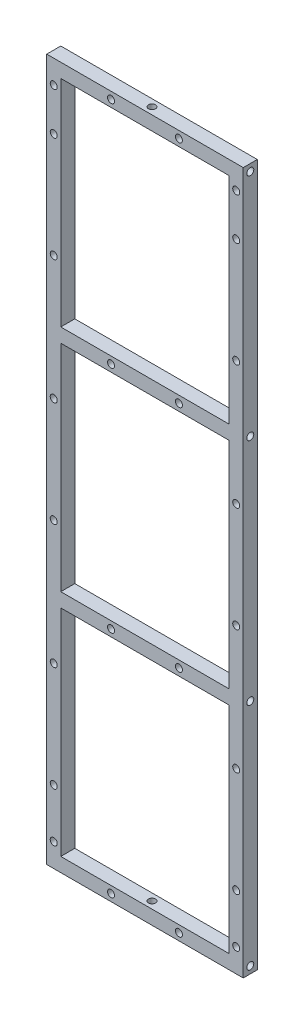
from build123d import *

# Parameters (mm, degrees)
SKETCH1_W            = 84
SKETCH1_H            = 300
SKETCH1_W_2          = 72
SKETCH1_H_2          = 92
BOSS_EXTRUDE1_DEPTH  = 6
SKETCH2_R            = 1.5
CUT_EXTRUDE1_DEPTH   = 10
SKETCH4_R            = 1.5
CUT_EXTRUDE3_DEPTH   = 10
SKETCH5_R            = 1.5
CUT_EXTRUDE4_DEPTH   = 10
SKETCH6_R            = 1.5
CUT_EXTRUDE5_DEPTH   = 10
LPATTERN1_COUNT      = 2
LPATTERN1_PITCH      = 78
LPATTERN1_COUNT_DIR2 = 2
LPATTERN1_PITCH_DIR2 = 280


with BuildPart() as part:
    # Sketch1 → Boss-Extrude1 (new body)
    with BuildSketch(Plane.XY):
        Rectangle(SKETCH1_W, SKETCH1_H)
        with Locations((0, 98)):
            Rectangle(SKETCH1_W_2, SKETCH1_H_2, mode=Mode.SUBTRACT)
        with Locations((0, -98)):
            Rectangle(SKETCH1_W_2, SKETCH1_H_2, mode=Mode.SUBTRACT)
        Rectangle(SKETCH1_W_2, SKETCH1_H_2, mode=Mode.SUBTRACT)
    extrude(amount=BOSS_EXTRUDE1_DEPTH)

    # Sketch2 → Cut-Extrude1 (cut)
    with BuildSketch(Plane(origin=(42, 0, 0), x_dir=(0, 0, -1), z_dir=(1, 0, 0))):
        with Locations((-3, 147)):
            Circle(SKETCH2_R)
        with Locations((-3, 49)):
            Circle(SKETCH2_R)
        with Locations((-3, -49)):
            Circle(SKETCH2_R)
        with Locations((-3, -147)):
            Circle(SKETCH2_R)
    cut_extrude1 = extrude(amount=-CUT_EXTRUDE1_DEPTH, mode=Mode.SUBTRACT)

    # Mirror1: Cut-Extrude1 across plane
    add(cut_extrude1.mirror(Plane(origin=(0, 0, 0), x_dir=(0, 0, 1), z_dir=(1, 0, 0))), mode=Mode.SUBTRACT)

    # Sketch4 → Cut-Extrude3 (cut)
    with BuildSketch(Plane.XY.offset(6)):
        with Locations((-14.5, 147)):
            Circle(SKETCH4_R)
        with Locations((14.5, 147)):
            Circle(SKETCH4_R)
        with Locations((14.5, 49)):
            Circle(SKETCH4_R)
        with Locations((-14.5, 49)):
            Circle(SKETCH4_R)
        with Locations((14.5, -49)):
            Circle(SKETCH4_R)
        with Locations((-14.5, -49)):
            Circle(SKETCH4_R)
        with Locations((14.5, -147)):
            Circle(SKETCH4_R)
        with Locations((-14.5, -147)):
            Circle(SKETCH4_R)
        with Locations((-39, 122)):
            Circle(SKETCH4_R)
        with Locations((-39, 77)):
            Circle(SKETCH4_R)
        with Locations((39, 122)):
            Circle(SKETCH4_R)
        with Locations((39, 77)):
            Circle(SKETCH4_R)
        with Locations((39, 24)):
            Circle(SKETCH4_R)
        with Locations((39, -21)):
            Circle(SKETCH4_R)
        with Locations((39, -74)):
            Circle(SKETCH4_R)
        with Locations((39, -119)):
            Circle(SKETCH4_R)
        with Locations((-39, 24)):
            Circle(SKETCH4_R)
        with Locations((-39, -21)):
            Circle(SKETCH4_R)
        with Locations((-39, -74)):
            Circle(SKETCH4_R)
        with Locations((-39, -119)):
            Circle(SKETCH4_R)
    extrude(amount=-CUT_EXTRUDE3_DEPTH, mode=Mode.SUBTRACT)

    # Sketch5 → Cut-Extrude4 (cut)
    with BuildSketch(Plane(origin=(0, 150, 0), x_dir=(1, 0, 0), z_dir=(0, 1, 0))):
        with Locations((0, -3)):
            Circle(SKETCH5_R)
    cut_extrude4 = extrude(amount=-CUT_EXTRUDE4_DEPTH, mode=Mode.SUBTRACT)

    # Mirror2: Cut-Extrude4 across plane
    add(cut_extrude4.mirror(Plane.ZX), mode=Mode.SUBTRACT)

    # Sketch6 → Cut-Extrude5 (cut)
    with BuildSketch(Plane.XY.offset(6)):
        with Locations((-39, 140)):
            Circle(SKETCH6_R)
    cut_extrude5 = extrude(amount=-CUT_EXTRUDE5_DEPTH, mode=Mode.SUBTRACT)

    # LPattern1: Cut-Extrude5 2 × 2
    with Locations(*[(i * LPATTERN1_PITCH, -j * LPATTERN1_PITCH_DIR2, 0) for i in range(LPATTERN1_COUNT) for j in range(LPATTERN1_COUNT_DIR2) if (i, j) != (0, 0)]):
        add(cut_extrude5, mode=Mode.SUBTRACT)


solid = part.part
